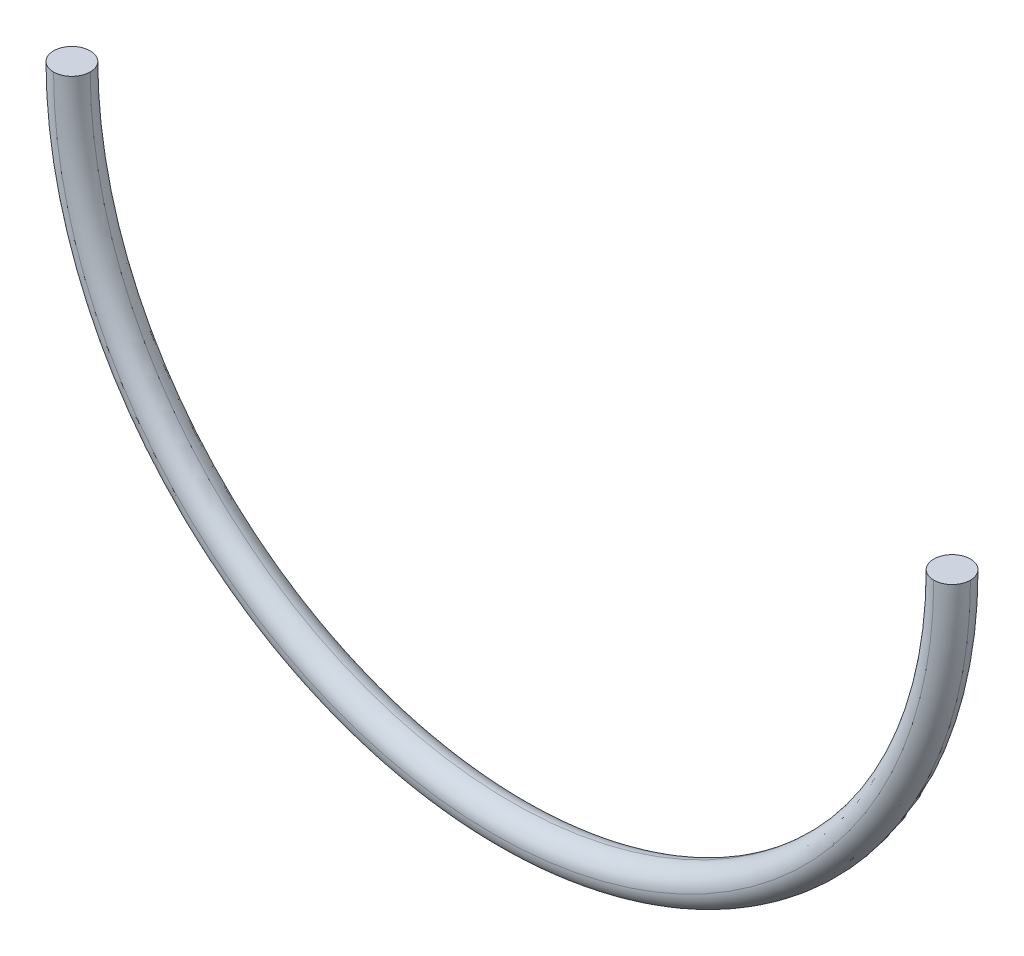
from build123d import *

# Parameters (mm, degrees)
BOSS_EXTRUDE2_DEPTH = 6
FILLET1_R           = 3


with BuildPart() as part:
    # Sketch1 → Boss-Extrude2 (new body)
    with BuildSketch(Plane.XY):
        with BuildLine():
            Line((-75, 0), (-69, 0))
            ThreePointArc((-69, 0), (0, -69), (69, 0))
            Line((69, 0), (75, 0))
            ThreePointArc((75, 0), (0, -75), (-75, 0))
        make_face()
    extrude(amount=-BOSS_EXTRUDE2_DEPTH)

    # Fillet1
    fillet1_edges = [part.edges().sort_by_distance(p)[0] for p in [
        (0, -69, -6),
        (0, -69, 0),
        (0, -75, -6),
        (0, -75, 0),
    ]]
    fillet(fillet1_edges, radius=FILLET1_R - 0.0001)  # a hair under: the kernel refuses the full size


solid = part.part
